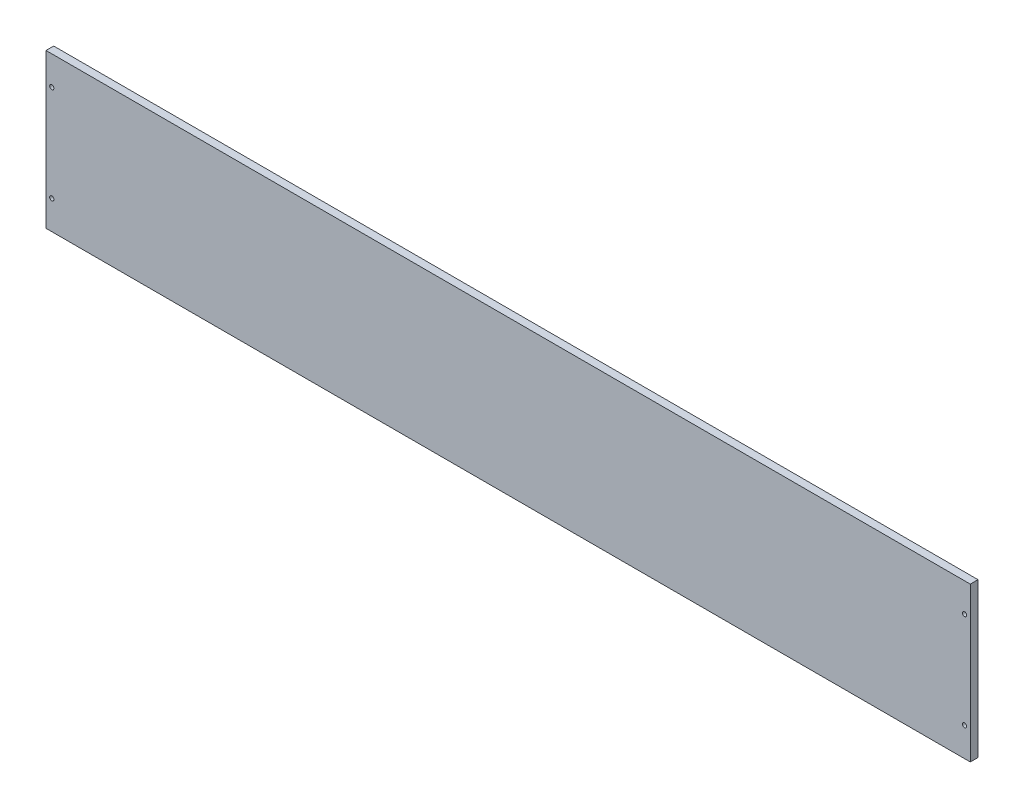
from build123d import *

# Parameters (mm, degrees)
ESQUISSE1_W             = 1200
ESQUISSE1_H             = 200
BOSS_EXTRU_1_DEPTH      = 10
ESQUISSE2_R             = 2.75
ENL_V_MAT_EXTRU_1_DEPTH = 10
CHANFREIN1_SIZE         = 2.5


with BuildPart() as part:
    # Esquisse1 → Boss.-Extru.1 (new body)
    with BuildSketch(Plane.XY):
        with Locations((600, -100)):
            Rectangle(ESQUISSE1_W, ESQUISSE1_H)
    extrude(amount=BOSS_EXTRU_1_DEPTH)

    # Esquisse2 → Enlèv. mat.-Extru.1 (cut)
    with BuildSketch(Plane.XY.offset(10)):
        with Locations((7.5, -37.5)):
            Circle(ESQUISSE2_R)
        with Locations((7.5, -162.5)):
            Circle(ESQUISSE2_R)
        with Locations((1192.5, -37.5)):
            Circle(ESQUISSE2_R)
        with Locations((1192.5, -162.5)):
            Circle(ESQUISSE2_R)
    extrude(amount=-ENL_V_MAT_EXTRU_1_DEPTH, mode=Mode.SUBTRACT)

    # Chanfrein1
    chanfrein1_edges = [part.edges().sort_by_distance(p)[0] for p in [
        (4.75, -162.5, 0),
        (4.75, -37.5, 0),
        (1189.75, -37.5, 0),
        (1189.75, -162.5, 0),
    ]]
    chamfer(chanfrein1_edges, length=CHANFREIN1_SIZE)


solid = part.part
